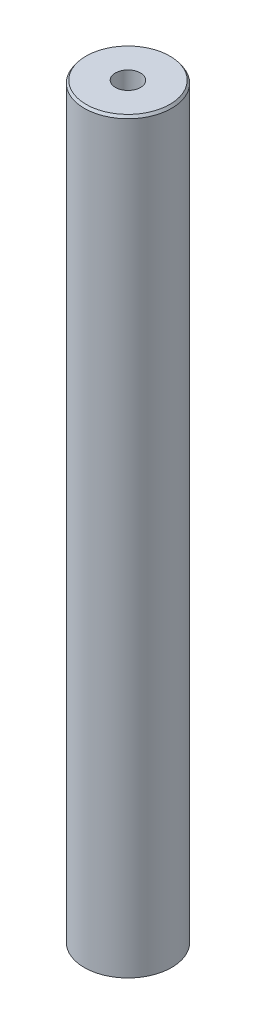
from build123d import *
from OCP.BRepFilletAPI import BRepFilletAPI_MakeChamfer

# Parameters (mm, degrees)
SKETCH1_R           = 35
BOSS_EXTRUDE1_DEPTH = 600
SKETCH2_R           = 10.081932734
CUT_EXTRUDE1_DEPTH  = 603.038204768
CHAMFER1_SIZE       = 2.032372105
CHAMFER1_SIZE2      = 1.414702689


with BuildPart() as part:
    # Sketch1 → Boss-Extrude1 (new body)
    with BuildSketch(Plane(origin=(0, 0, 0), x_dir=(1, 0, 0), z_dir=(0, 1, 0))):
        Circle(SKETCH1_R)
    extrude(amount=BOSS_EXTRUDE1_DEPTH)

    # Sketch2 → Cut-Extrude1 (cut, through all)
    with BuildSketch(Plane(origin=(0, 0, 0), x_dir=(1, 0, 0), z_dir=(0, 1, 0))):
        Circle(SKETCH2_R)
    extrude(amount=CUT_EXTRUDE1_DEPTH, mode=Mode.SUBTRACT)

    # Chamfer1: one chamfer whose edges measure the first distance from different faces: ONE call of the kernel's chamfer builder (chamfer() names one face for all edges)
    chamfer1_edges_1 = [part.edges().sort_by_distance(p)[0] for p in [
        (-35, 600, 0),
    ]]
    chamfer1_side_1 = [part.faces().sort_by_distance(p)[0] for p in [
        (-35, 300, 0),
    ]]
    chamfer1_edges_2 = [part.edges().sort_by_distance(p)[0] for p in [
        (-35, 0, 0),
    ]]
    chamfer1_side_2 = [part.faces().sort_by_distance(p)[0] for p in [
        (-34.010050506, 0, 0),
    ]]
    chamfer1 = BRepFilletAPI_MakeChamfer(part.part.solid().wrapped)
    for e in chamfer1_edges_1:
        chamfer1.Add(CHAMFER1_SIZE, CHAMFER1_SIZE2, e.wrapped, chamfer1_side_1[0].wrapped)  # the first distance lies on this face
    for e in chamfer1_edges_2:
        chamfer1.Add(CHAMFER1_SIZE, CHAMFER1_SIZE2, e.wrapped, chamfer1_side_2[0].wrapped)  # the first distance lies on this face
    add(Compound.cast(chamfer1.Shape()), mode=Mode.REPLACE)


solid = part.part
